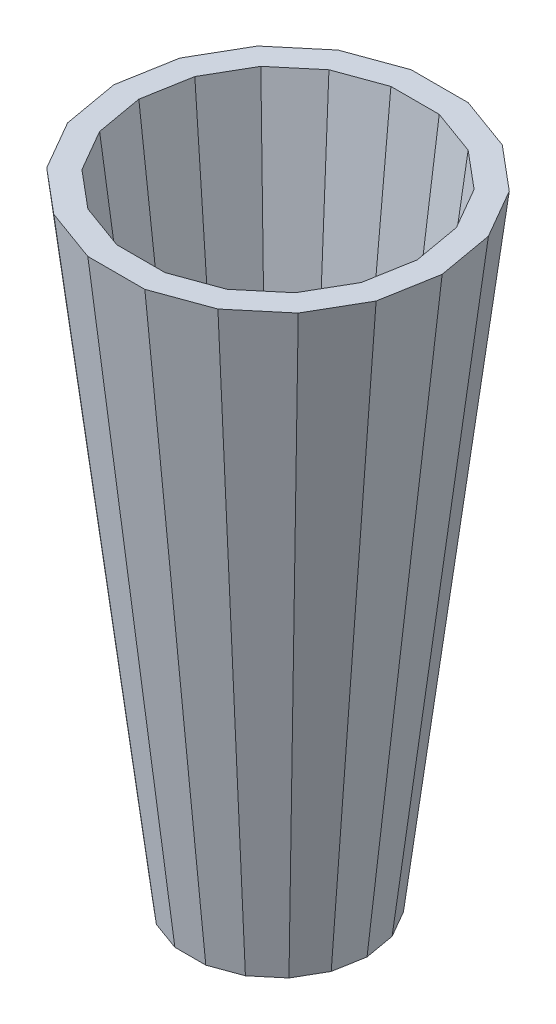
from build123d import *

# Parameters (mm, degrees)
LOFT1_DEPTH        = 508
LOFT1_DRAFT        = -6.7116474
SHELL1_T           = -19.05
SKETCH5_R          = 147.867108762
CUT_EXTRUDE1_DEPTH = 17.78
CUT_EXTRUDE2_DEPTH = 528.39436013
CUT_EXTRUDE2_TAPER = -20


# Read off the part's stored shape, not the designer's step: Loft1
with BuildPart() as part:
    # Loft1 outline → Loft1 (with draft: the straight prism first)
    with BuildSketch(Plane(origin=(0, -508, 0), x_dir=(1, 0, 0), z_dir=(0, 1, 0))):
        Polygon((33.642737163, -58.270930071), (51.543663709, -43.250269208), (63.227663709, -23.012987572), (67.285474325, 0), (63.227663709, 23.012987572), (51.543663709, 43.250269208), (33.642737163, 58.270930071), (11.684, 66.26325678), (-11.684, 66.26325678), (-33.642737163, 58.270930071), (-51.543663709, 43.250269208), (-63.227663709, 23.012987572), (-67.285474325, 0), (-63.227663709, -23.012987572), (-51.543663709, -43.250269208), (-33.642737163, -58.270930071), (-11.684, -66.26325678), (11.684, -66.26325678), align=None)
    extrude(amount=LOFT1_DEPTH)
    # Loft1: the draft: its side faces are tilted about the plane it starts from
    loft1_sides = [part.faces().sort_by_distance(p)[0] for p in [
        (42.593200436, -254, 50.76059964),
        (57.385663709, -254, 33.13162839),
        (65.256569017, -254, 11.506493786),
        (65.256569017, -254, -11.506493786),
        (57.385663709, -254, -33.13162839),
        (42.593200436, -254, -50.76059964),
        (22.663368581, -254, -62.267093426),
        (0, -254, -66.26325678),
        (-22.663368582, -254, -62.267093426),
        (-42.593200436, -254, -50.76059964),
        (-57.385663709, -254, -33.13162839),
        (-65.256569017, -254, -11.506493786),
        (-65.256569017, -254, 11.506493786),
        (-57.385663709, -254, 33.13162839),
        (-42.593200436, -254, 50.76059964),
        (-22.663368581, -254, 62.267093426),
        (0, -254, 66.26325678),
        (22.663368582, -254, 62.267093426),
    ]]
    draft(loft1_sides, Plane(origin=(0, -508, 0), x_dir=(1, 0, 0), z_dir=(0, 1, 0)), LOFT1_DRAFT)

    # Shell1
    shell1_openings = [part.faces().sort_by_distance(p)[0] for p in [
        (0, 0, 0),
        (0, -508, 0),
    ]]
    offset(amount=SHELL1_T, openings=shell1_openings, kind=Kind.INTERSECTION)

    # Sketch5 → Cut-Extrude1 (cut)
    with BuildSketch(Plane.XZ.offset(508)):
        Circle(SKETCH5_R)
    extrude(amount=-CUT_EXTRUDE1_DEPTH, mode=Mode.SUBTRACT)

    # Sketch6 → Cut-Extrude2 (cut, through all)
    with BuildSketch(Plane(origin=(-55.116718082, -475.589831727, -9.718564486), x_dir=(0.17364817766692822, 0, -0.9848077530122085), z_dir=(-0.11509707458405294, -0.9931469114771136, -0.020294719649782803))):
        Polygon((-12.052935, 125.180446117), (-8.67072745, 106.130446117), (8.67072745, 106.130446117), (12.052935, 125.180446117), align=None)
    extrude(amount=CUT_EXTRUDE2_DEPTH, taper=CUT_EXTRUDE2_TAPER, mode=Mode.SUBTRACT)


solid = part.part
